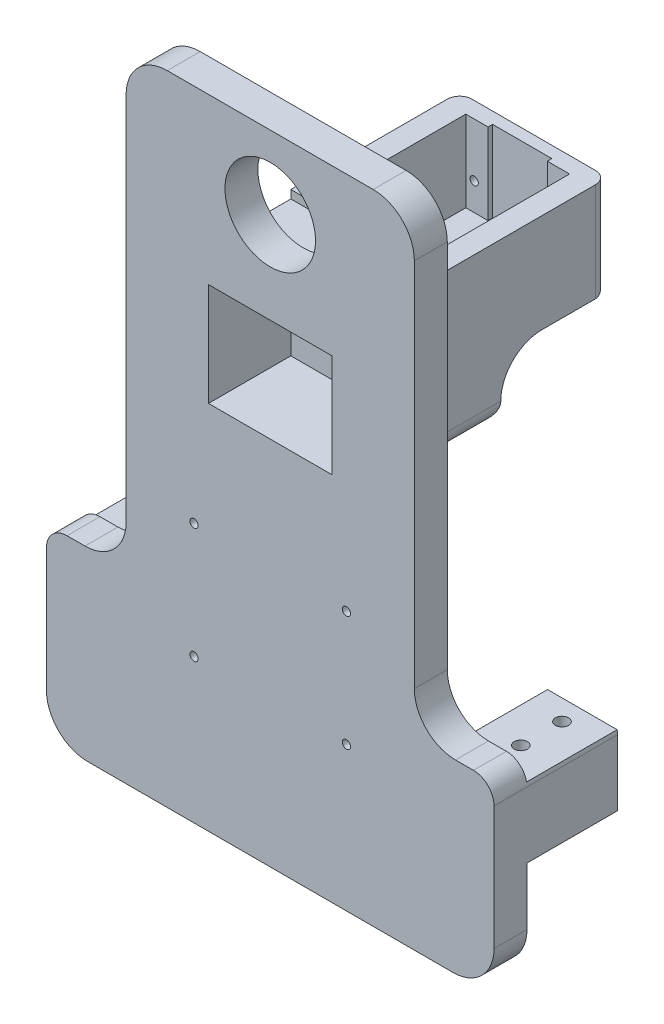
from build123d import *

# Parameters (mm, degrees)
SKETCH_3_W            = 36
SKETCH_3_H            = 50
EXTRUDE_1_DEPTH       = 24
SKETCH_4_W            = 24.8
SKETCH_4_H            = 31.8
CUT_EXTRUDE_1_DEPTH   = 19.7
SKETCH_5_W            = 14
SKETCH_5_H            = 2.2
CUT_EXTRUDE_3_DEPTH   = 19.7
SKETCH_6_W            = 18.5
SKETCH_6_H            = 3.8
CUT_EXTRUDE_4_DEPTH   = 14.7
SKETCH_7_W            = 24.8
SKETCH_7_H            = 24.280407208
CUT_EXTRUDE_5_DEPTH   = 2
SKETCH_8_R            = 2
CUT_EXTRUDE_6_DEPTH   = 6.4
SKETCH_9_R            = 1
CUT_EXTRUDE_7_DEPTH   = 6.4
SKETCH_10_R           = 2
CUT_EXTRUDE_8_DEPTH   = 7.4
SKETCH_11_R           = 1
CUT_EXTRUDE_9_DEPTH   = 7.4
SKETCH_14_W           = 47.693248889
SKETCH_14_H           = 41.94352182
CUT_EXTRUDE_12_DEPTH  = 4
SKETCH_16_W           = 69.166934332
SKETCH_16_H           = 39.422219991
CUT_EXTRUDE_13_DEPTH  = 5
CUT_EXTRUDE_17_DEPTH  = 19.7
SKETCH_19_W           = 18.9
SKETCH_19_H           = 2.1
CUT_EXTRUDE_18_DEPTH  = 12.7
SKETCH_20_W           = 36
SKETCH_20_H           = 30
EXTRUDE_2_DEPTH       = 15
SKETCH_22_W           = 70
SKETCH_22_H           = 130
EXTRUDE_3_DEPTH       = 8
SKETCH_25_W           = 36
SKETCH_25_H           = 15
EXTRUDE_5_DEPTH       = 22
SKETCH_26_OUTSIDE_W   = 104.184
SKETCH_26_OUTSIDE_H   = 164.184
SKETCH_26_OUTSIDE_W_2 = 70
SKETCH_26_OUTSIDE_H_2 = 130
SKETCH_26_OUTSIDE_R   = 2
SKETCH_26_OUTSIDE_R_2 = 11
CUT_EXTRUDE_21_DEPTH  = 23
SKETCH_28_W           = 8
SKETCH_28_H           = 25
EXTRUDE_6_DEPTH       = 19.356
SKETCH_27_W           = 17
SKETCH_27_H           = 17
SKETCH_27_W_2         = 12.1
SKETCH_27_H_2         = 12.1
EXTRUDE_7_DEPTH       = 22
SKETCH_29_W           = 70
SKETCH_29_H           = 8
EXTRUDE_8_DEPTH       = 5
SKETCH_30_R           = 1.6
CUT_EXTRUDE_22_DEPTH  = 45
FILLET_2_R            = 10
FILLET_3_R            = 5
FILLET_4_R            = 10
SKETCH_31_R           = 2.5
EXTRUDE_9_DEPTH       = 5
SKETCH_34_R           = 1
CUT_EXTRUDE_27_DEPTH  = 31
SKETCH_35_W           = 25.2
SKETCH_35_H           = 37.822381246
CUT_EXTRUDE_28_DEPTH  = 2
FILLET_5_R            = 5
FILLET_6_R            = 3
SKETCH_36_W           = 30
SKETCH_36_H           = 25
CUT_EXTRUDE_29_DEPTH  = 20
SKETCH_37_W           = 108.712
SKETCH_37_H           = 8
EXTRUDE_10_DEPTH      = 20
FILLET_7_R            = 10


with BuildPart() as part:
    # 草图3 → 凸台-拉伸1 (new body)
    with BuildSketch(Plane(origin=(0, 0, 0), x_dir=(1, 0, 0), z_dir=(0, 1, 0))):
        Rectangle(SKETCH_3_W, SKETCH_3_H)
    extrude(amount=EXTRUDE_1_DEPTH)

    # 草图4 → 切除-拉伸1 (cut)
    with BuildSketch(Plane(origin=(0, 24, 0), x_dir=(1, 0, 0), z_dir=(0, 1, 0))):
        Rectangle(SKETCH_4_W, SKETCH_4_H)
    extrude(amount=-CUT_EXTRUDE_1_DEPTH, mode=Mode.SUBTRACT)

    # 草图5 → 切除-拉伸3 (cut)
    with BuildSketch(Plane(origin=(0, 24, 0), x_dir=(1, 0, 0), z_dir=(0, 1, 0))):
        with Locations((0, 15.9)):
            Rectangle(SKETCH_5_W, SKETCH_5_H)
    extrude(amount=-CUT_EXTRUDE_3_DEPTH, mode=Mode.SUBTRACT)

    # 草图6 → 切除-拉伸4 (cut)
    with BuildSketch(Plane(origin=(0, 24, 0), x_dir=(1, 0, 0), z_dir=(0, 1, 0))):
        with Locations((0, -15.9)):
            Rectangle(SKETCH_6_W, SKETCH_6_H)
    extrude(amount=-CUT_EXTRUDE_4_DEPTH, mode=Mode.SUBTRACT)

    # 草图7 → 切除-拉伸5 (cut)
    with BuildSketch(Plane(origin=(0, 24, 0), x_dir=(1, 0, 0), z_dir=(0, 1, 0))):
        with Locations((0, -25)):
            Rectangle(SKETCH_7_W, SKETCH_7_H)
    extrude(amount=-CUT_EXTRUDE_5_DEPTH, mode=Mode.SUBTRACT)

    # 草图8 → 切除-拉伸6 (cut)
    with BuildSketch(Plane.XY.offset(25)):
        with Locations((10.65, 7.2)):
            Circle(SKETCH_8_R)
        with Locations((-10.65, 7.2)):
            Circle(SKETCH_8_R)
    extrude(amount=-CUT_EXTRUDE_6_DEPTH, mode=Mode.SUBTRACT)

    # 草图9 → 切除-拉伸7 (cut)
    with BuildSketch(Plane.XY.offset(18.6)):
        with Locations((10.65, 7.2)):
            Circle(SKETCH_9_R)
        with Locations((-10.65, 7.2)):
            Circle(SKETCH_9_R)
    extrude(amount=-CUT_EXTRUDE_7_DEPTH, mode=Mode.SUBTRACT)

    # 草图10 → 切除-拉伸8 (cut)
    with BuildSketch(Plane(origin=(0, 0, -25), x_dir=(-1, 0, 0), z_dir=(0, 0, -1))):
        with Locations((-10.565, 11)):
            Circle(SKETCH_10_R)
        with Locations((10.56, 11)):
            Circle(SKETCH_10_R)
    extrude(amount=-CUT_EXTRUDE_8_DEPTH, mode=Mode.SUBTRACT)

    # 草图11 → 切除-拉伸9 (cut)
    with BuildSketch(Plane(origin=(0, 0, -17.6), x_dir=(-1, 0, 0), z_dir=(0, 0, -1))):
        with Locations((10.56, 11)):
            Circle(SKETCH_11_R)
        with Locations((-10.565, 11)):
            Circle(SKETCH_11_R)
    extrude(amount=-CUT_EXTRUDE_9_DEPTH, mode=Mode.SUBTRACT)

    # 草图14 → 切除-拉伸12 (cut)
    with BuildSketch(Plane.XY.offset(25)):
        with Locations((-2.653720185, 12.393348568)):
            Rectangle(SKETCH_14_W, SKETCH_14_H)
    extrude(amount=-CUT_EXTRUDE_12_DEPTH, mode=Mode.SUBTRACT)

    # 草图16 → 切除-拉伸13 (cut)
    with BuildSketch(Plane(origin=(0, 0, -25), x_dir=(-1, 0, 0), z_dir=(0, 0, -1))):
        with Locations((0.858826259, 12.588310345)):
            Rectangle(SKETCH_16_W, SKETCH_16_H)
    extrude(amount=-CUT_EXTRUDE_13_DEPTH, mode=Mode.SUBTRACT)

    # 草图18 → 切除-拉伸17 (cut)
    with BuildSketch(Plane(origin=(0, 24, 0), x_dir=(1, 0, 0), z_dir=(0, 1, 0))):
        Polygon((-12.6, -16.1), (12.6, -16.1), (12.6, 16.1), (7.2, 16.1), (7.2, 17.2), (-7.2, 17.2), (-7.2, 16.1), (-12.6, 16.1), align=None)
    extrude(amount=-CUT_EXTRUDE_17_DEPTH, mode=Mode.SUBTRACT)

    # 草图19 → 切除-拉伸18 (cut)
    with BuildSketch(Plane(origin=(0, 22, 0), x_dir=(1, 0, 0), z_dir=(0, 1, 0))):
        with Locations((0, -16.95)):
            Rectangle(SKETCH_19_W, SKETCH_19_H)
    extrude(amount=-CUT_EXTRUDE_18_DEPTH, mode=Mode.SUBTRACT)

    # 草图20 → 凸台-拉伸2 (add)
    with BuildSketch(Plane.XZ):
        with Locations((0, 21)):
            Rectangle(SKETCH_20_W, SKETCH_20_H)
    extrude(amount=EXTRUDE_2_DEPTH)

    # 草图22 → 凸台-拉伸3 (add)
    with BuildSketch(Plane.XY.offset(36)):
        with Locations((0, -13)):
            Rectangle(SKETCH_22_W, SKETCH_22_H)
    extrude(amount=EXTRUDE_3_DEPTH)

    # 草图25 → 凸台-拉伸5 (add)
    with BuildSketch(Plane(origin=(0, 0, 0), x_dir=(1, 0, 0), z_dir=(0, 1, 0))):
        with Locations((0, -28.5)):
            Rectangle(SKETCH_25_W, SKETCH_25_H)
    extrude(amount=EXTRUDE_5_DEPTH)

    # 草图26 outside → 切除-拉伸21 (cut)
    # profile 1 of 4: a face of its own
    with BuildSketch(Plane.XY.offset(44)):
        with Locations((0, -13)):
            Rectangle(SKETCH_26_OUTSIDE_W, SKETCH_26_OUTSIDE_H)
        with Locations((0, -13)):
            Rectangle(SKETCH_26_OUTSIDE_W_2, SKETCH_26_OUTSIDE_H_2, mode=Mode.SUBTRACT)
    # profile 2 of 4: a face of its own
    with BuildSketch(Plane.XY.offset(44)):
        with Locations((10.65, 7.2)):
            Circle(SKETCH_26_OUTSIDE_R)
    # profile 3 of 4: a face of its own
    with BuildSketch(Plane.XY.offset(44)):
        with Locations((-10.65, 7.2)):
            Circle(SKETCH_26_OUTSIDE_R)
    # profile 4 of 4: a face of its own
    with BuildSketch(Plane.XY.offset(44)):
        with Locations((0, 39.208)):
            Circle(SKETCH_26_OUTSIDE_R_2)
    extrude(amount=-CUT_EXTRUDE_21_DEPTH, mode=Mode.SUBTRACT)

    # 草图28 → 凸台-拉伸6 (add)
    with BuildSketch(Plane(origin=(35, 0, 0), x_dir=(0, 0, -1), z_dir=(1, 0, 0))):
        with Locations((-40, -65.5)):
            Rectangle(SKETCH_28_W, SKETCH_28_H)
    extrude_6 = extrude(amount=EXTRUDE_6_DEPTH)

    # 草图27 → 凸台-拉伸7 (add)
    with BuildSketch(Plane(origin=(0, 0, 36), x_dir=(-1, 0, 0), z_dir=(0, 0, -1))):
        with Locations((-45.856, -65.5)):
            Rectangle(SKETCH_27_W, SKETCH_27_H)
        with Locations((-45.856, -65.5)):
            Rectangle(SKETCH_27_W_2, SKETCH_27_H_2, mode=Mode.SUBTRACT)
    extrude_7 = extrude(amount=EXTRUDE_7_DEPTH)

    # 镜向1: 凸台-拉伸6, 凸台-拉伸7 across plane
    add(extrude_6.mirror(Plane(origin=(0, 0, 0), x_dir=(0, 0, 1), z_dir=(1, 0, 0))))
    add(extrude_7.mirror(Plane(origin=(0, 0, 0), x_dir=(0, 0, 1), z_dir=(1, 0, 0))))

    # 草图29 → 凸台-拉伸8 (add)
    with BuildSketch(Plane(origin=(0, 52, 0), x_dir=(1, 0, 0), z_dir=(0, 1, 0))):
        with Locations((0, -40)):
            Rectangle(SKETCH_29_W, SKETCH_29_H)
    extrude(amount=EXTRUDE_8_DEPTH)

    # 草图30 → 切除-拉伸22 (cut)
    with BuildSketch(Plane.XZ.offset(74)):
        with Locations(Location((45.856, 29, 0), (0, 0, 270))):
            Circle(SKETCH_30_R)
        with Locations(Location((45.856, 19, 0), (0, 0, 270))):
            Circle(SKETCH_30_R)
    cut_extrude_22 = extrude(amount=-CUT_EXTRUDE_22_DEPTH, mode=Mode.SUBTRACT)

    # 镜向2: 切除-拉伸22 across plane
    add(cut_extrude_22.mirror(Plane(origin=(0, 0, 0), x_dir=(0, 0, 1), z_dir=(1, 0, 0))), mode=Mode.SUBTRACT)

    # 圆角2
    fillet_2_edges = [part.edges().sort_by_distance(p)[0] for p in [
        (35, -53, 40),
        (-35, -53, 40),
    ]]
    fillet(fillet_2_edges, radius=FILLET_2_R)

    # 圆角3
    fillet_3_edges = [part.edges().sort_by_distance(p)[0] for p in [
        (-54.356, -53, 40),
        (54.356, -53, 40),
    ]]
    fillet(fillet_3_edges, radius=FILLET_3_R)

    # 圆角4
    fillet_4_edges = [part.edges().sort_by_distance(p)[0] for p in [
        (0, 0, 6),
    ]]
    fillet(fillet_4_edges, radius=FILLET_4_R)

    # 草图31 → 凸台-拉伸9 (add)
    with BuildSketch(Plane(origin=(0, 0, 36), x_dir=(-1, 0, 0), z_dir=(0, 0, -1))):
        with Locations((-18.5, -34.979705298)):
            Circle(SKETCH_31_R)
        with Locations((18.5, -34.979705298)):
            Circle(SKETCH_31_R)
        with Locations((18.5, -62.979705298)):
            Circle(SKETCH_31_R)
        with Locations((-18.5, -62.979705298)):
            Circle(SKETCH_31_R)
    extrude(amount=EXTRUDE_9_DEPTH)

    # 草图34 → 切除-拉伸27 (cut)
    with BuildSketch(Plane(origin=(0, 0, 31), x_dir=(-1, 0, 0), z_dir=(0, 0, -1))):
        with Locations((-18.5, -62.979705298)):
            Circle(SKETCH_34_R)
        with Locations((18.5, -62.979705298)):
            Circle(SKETCH_34_R)
        with Locations((18.5, -34.979705298)):
            Circle(SKETCH_34_R)
        with Locations((-18.5, -34.979705298)):
            Circle(SKETCH_34_R)
    extrude(amount=-CUT_EXTRUDE_27_DEPTH, mode=Mode.SUBTRACT)

    # 草图35 → 切除-拉伸28 (cut)
    with BuildSketch(Plane(origin=(0, 24, 0), x_dir=(1, 0, 0), z_dir=(0, 1, 0))):
        with Locations((0, -2.811190623)):
            Rectangle(SKETCH_35_W, SKETCH_35_H)
    extrude(amount=-CUT_EXTRUDE_28_DEPTH, mode=Mode.SUBTRACT)

    # 圆角5
    fillet_5_edges = [part.edges().sort_by_distance(p)[0] for p in [
        (18, 3.5, 36),
        (0, 22, 36),
        (0, -15, 36),
        (-18, 3.5, 36),
        (18, -15, 21),
        (-18, -15, 21),
        (0, -15, 6),
    ]]
    fillet(fillet_5_edges, radius=FILLET_5_R - 0.0001)  # a hair under: the kernel refuses the full size

    # 圆角6
    fillet_6_edges = [part.edges().sort_by_distance(p)[0] for p in [
        (0, 0, -20),
        (-18, 12, -20),
        (18, 12, -20),
    ]]
    fillet(fillet_6_edges, radius=FILLET_6_R)

    # 草图36 → 切除-拉伸29 (cut)
    with BuildSketch(Plane.XY.offset(44)):
        with Locations((0, 4.5)):
            Rectangle(SKETCH_36_W, SKETCH_36_H)
    extrude(amount=-CUT_EXTRUDE_29_DEPTH, mode=Mode.SUBTRACT)

    # 草图37 → 凸台-拉伸10 (add)
    with BuildSketch(Plane.XZ.offset(78)):
        with Locations((0, 40)):
            Rectangle(SKETCH_37_W, SKETCH_37_H)
    extrude(amount=EXTRUDE_10_DEPTH)

    # 圆角7
    fillet_7_edges = [part.edges().sort_by_distance(p)[0] for p in [
        (-35, 57, 40),
        (35, 57, 40),
        (-54.356, -98, 40),
        (54.356, -98, 40),
    ]]
    fillet(fillet_7_edges, radius=FILLET_7_R)


solid = part.part
